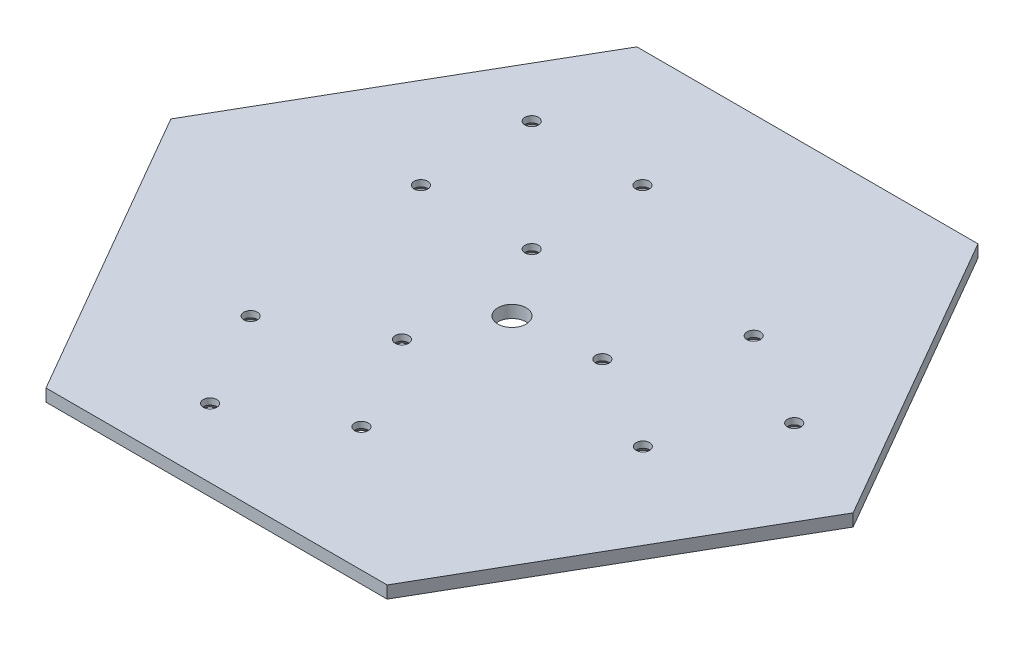
from build123d import *

# Parameters (mm, degrees)
BOSS_EXTRUDE1_DEPTH                            = 5
SKETCH5_R                                      = 5.753179175
CUT_EXTRUDE1_DEPTH                             = 184.371208209
CSK_FOR_M5_FLAT_HEAD_MACHINE_SCREW1_AT_2_COUNT = 2
CSK_FOR_M5_FLAT_HEAD_MACHINE_SCREW1_AT_2_PITCH = 45
CSK_FOR_M5_FLAT_HEAD_MACHINE_SCREW1_AT_3_COUNT = 2
CSK_FOR_M5_FLAT_HEAD_MACHINE_SCREW1_AT_3_PITCH = 63.639610307
CSK_FOR_M5_FLAT_HEAD_MACHINE_SCREW1_AT_4_COUNT = 2
CSK_FOR_M5_FLAT_HEAD_MACHINE_SCREW1_AT_4_PITCH = 45
CSK_FOR_M5_FLAT_HEAD_MACHINE_SCREW1_AT_5_COUNT = 2
CSK_FOR_M5_FLAT_HEAD_MACHINE_SCREW1_AT_5_PITCH = 101.046587643
CSK_FOR_M5_FLAT_HEAD_MACHINE_SCREW1_AT_6_COUNT = 2
CSK_FOR_M5_FLAT_HEAD_MACHINE_SCREW1_AT_6_PITCH = 144.828140716
CSK_FOR_M5_FLAT_HEAD_MACHINE_SCREW1_AT_7_COUNT = 2
CSK_FOR_M5_FLAT_HEAD_MACHINE_SCREW1_AT_7_PITCH = 159.73189246
CSK_FOR_M5_FLAT_HEAD_MACHINE_SCREW1_AT_8_COUNT = 2
CSK_FOR_M5_FLAT_HEAD_MACHINE_SCREW1_AT_8_PITCH = 121.44751953
CSK_FOR_M5_FLAT_HEAD_MACHINE_SCREW1_AT_9_COUNT = 2
CSK_FOR_M5_FLAT_HEAD_MACHINE_SCREW1_AT_9_PITCH = 76.964843439
CSK_FOR_M5_FLAT_HEAD_MACHINE_SCREW1_AT_1_COUNT = 2
CSK_FOR_M5_FLAT_HEAD_MACHINE_SCREW1_AT_1_PITCH = 121.44751953
CSK_FOR_M5_FLAT_HEAD_MACHINE_SCREW1_2_COUNT    = 2
CSK_FOR_M5_FLAT_HEAD_MACHINE_SCREW1_2_PITCH    = 124.337132551
CSK_FOR_M5_FLAT_HEAD_MACHINE_SCREW1_3_COUNT    = 2
CSK_FOR_M5_FLAT_HEAD_MACHINE_SCREW1_3_PITCH    = 81.448202292


with BuildPart() as part:
    # Sketch1 → Boss-Extrude1 (new body)
    with BuildSketch(Plane(origin=(0, 0, 0), x_dir=(1, 0, 0), z_dir=(0, 1, 0))):
        Polygon((69.282032303, 120), (-69.282032303, 120), (-138.564064606, 0), (-69.282032303, -120), (69.282032303, -120), (138.564064606, 0), align=None)
    extrude(amount=BOSS_EXTRUDE1_DEPTH)

    # Sketch5 → Cut-Extrude1 (cut, through all)
    with BuildSketch(Plane(origin=(0, 5, 0), x_dir=(1, 0, 0), z_dir=(0, 1, 0))):
        Circle(SKETCH5_R)
    extrude(amount=-CUT_EXTRUDE1_DEPTH, mode=Mode.SUBTRACT)

    # Sketch6 → CSK for M5 Flat Head Machine Screw1 (revolve, cut)
    with BuildSketch(Plane(origin=(-64.5, 0, -27.5), x_dir=(0, 0, -1), z_dir=(1, 0, 0))):
        Polygon((0, 0), (0, 5), (2.75, 5), (2.75, 2.45), (5.2, 0), align=None)
    csk_for_m5_flat_head_machine_screw1 = revolve(axis=Axis((-64.5, -6.35, -27.5), (0, 1, 0)), mode=Mode.SUBTRACT)

    # CSK for M5 Flat Head Machine Screw1 at 2: CSK for M5 Flat Head Machine Screw1 ×2
    with Locations(*[(i * CSK_FOR_M5_FLAT_HEAD_MACHINE_SCREW1_AT_2_PITCH, 0, 0) for i in range(1, CSK_FOR_M5_FLAT_HEAD_MACHINE_SCREW1_AT_2_COUNT)]):
        add(csk_for_m5_flat_head_machine_screw1, mode=Mode.SUBTRACT)

    # CSK for M5 Flat Head Machine Screw1 at 3: CSK for M5 Flat Head Machine Screw1 ×2
    with Locations(*[Vector(0.7071067811865467, 0, -0.7071067811865485) * (i * CSK_FOR_M5_FLAT_HEAD_MACHINE_SCREW1_AT_3_PITCH) for i in range(1, CSK_FOR_M5_FLAT_HEAD_MACHINE_SCREW1_AT_3_COUNT)]):
        add(csk_for_m5_flat_head_machine_screw1, mode=Mode.SUBTRACT)

    # CSK for M5 Flat Head Machine Screw1 at 4: CSK for M5 Flat Head Machine Screw1 ×2
    with Locations(*[(0, 0, -i * CSK_FOR_M5_FLAT_HEAD_MACHINE_SCREW1_AT_4_PITCH) for i in range(1, CSK_FOR_M5_FLAT_HEAD_MACHINE_SCREW1_AT_4_COUNT)]):
        add(csk_for_m5_flat_head_machine_screw1, mode=Mode.SUBTRACT)

    # CSK for M5 Flat Head Machine Screw1 at 5: CSK for M5 Flat Head Machine Screw1 ×2
    with Locations(*[Vector(0.9704998544848913, 0, 0.2411017056032681) * (i * CSK_FOR_M5_FLAT_HEAD_MACHINE_SCREW1_AT_5_PITCH) for i in range(1, CSK_FOR_M5_FLAT_HEAD_MACHINE_SCREW1_AT_5_COUNT)]):
        add(csk_for_m5_flat_head_machine_screw1, mode=Mode.SUBTRACT)

    # CSK for M5 Flat Head Machine Screw1 at 6: CSK for M5 Flat Head Machine Screw1 ×2
    with Locations(*[Vector(0.9462031418522925, 0, 0.32357319782214755) * (i * CSK_FOR_M5_FLAT_HEAD_MACHINE_SCREW1_AT_6_PITCH) for i in range(1, CSK_FOR_M5_FLAT_HEAD_MACHINE_SCREW1_AT_6_COUNT)]):
        add(csk_for_m5_flat_head_machine_screw1, mode=Mode.SUBTRACT)

    # CSK for M5 Flat Head Machine Screw1 at 7: CSK for M5 Flat Head Machine Screw1 ×2
    with Locations(*[Vector(0.9987788870275944, 0, 0.04940379365918945) * (i * CSK_FOR_M5_FLAT_HEAD_MACHINE_SCREW1_AT_7_PITCH) for i in range(1, CSK_FOR_M5_FLAT_HEAD_MACHINE_SCREW1_AT_7_COUNT)]):
        add(csk_for_m5_flat_head_machine_screw1, mode=Mode.SUBTRACT)

    # CSK for M5 Flat Head Machine Screw1 at 8: CSK for M5 Flat Head Machine Screw1 ×2
    with Locations(*[Vector(0.9927390783329083, 0, -0.12028766499823594) * (i * CSK_FOR_M5_FLAT_HEAD_MACHINE_SCREW1_AT_8_PITCH) for i in range(1, CSK_FOR_M5_FLAT_HEAD_MACHINE_SCREW1_AT_8_COUNT)]):
        add(csk_for_m5_flat_head_machine_screw1, mode=Mode.SUBTRACT)

    # CSK for M5 Flat Head Machine Screw1 at 9: CSK for M5 Flat Head Machine Screw1 ×2
    with Locations(*[Vector(0.6552901187373239, 0, 0.7553772966440175) * (i * CSK_FOR_M5_FLAT_HEAD_MACHINE_SCREW1_AT_9_PITCH) for i in range(1, CSK_FOR_M5_FLAT_HEAD_MACHINE_SCREW1_AT_9_COUNT)]):
        add(csk_for_m5_flat_head_machine_screw1, mode=Mode.SUBTRACT)

    # CSK for M5 Flat Head Machine Screw1 at 1: CSK for M5 Flat Head Machine Screw1 ×2
    with Locations(*[Vector(0.6005417128168388, 0, 0.7995934286667303) * (i * CSK_FOR_M5_FLAT_HEAD_MACHINE_SCREW1_AT_1_PITCH) for i in range(1, CSK_FOR_M5_FLAT_HEAD_MACHINE_SCREW1_AT_1_COUNT)]):
        add(csk_for_m5_flat_head_machine_screw1, mode=Mode.SUBTRACT)

    # CSK for M5 Flat Head Machine Screw1  2: CSK for M5 Flat Head Machine Screw1 ×2
    with Locations(*[Vector(0.2731537838197167, 0, 0.9619703791619426) * (i * CSK_FOR_M5_FLAT_HEAD_MACHINE_SCREW1_2_PITCH) for i in range(1, CSK_FOR_M5_FLAT_HEAD_MACHINE_SCREW1_2_COUNT)]):
        add(csk_for_m5_flat_head_machine_screw1, mode=Mode.SUBTRACT)

    # CSK for M5 Flat Head Machine Screw1  3: CSK for M5 Flat Head Machine Screw1 ×2
    with Locations(*[Vector(0.14074169721357913, 0, 0.9900463497561319) * (i * CSK_FOR_M5_FLAT_HEAD_MACHINE_SCREW1_3_PITCH) for i in range(1, CSK_FOR_M5_FLAT_HEAD_MACHINE_SCREW1_3_COUNT)]):
        add(csk_for_m5_flat_head_machine_screw1, mode=Mode.SUBTRACT)


solid = part.part
